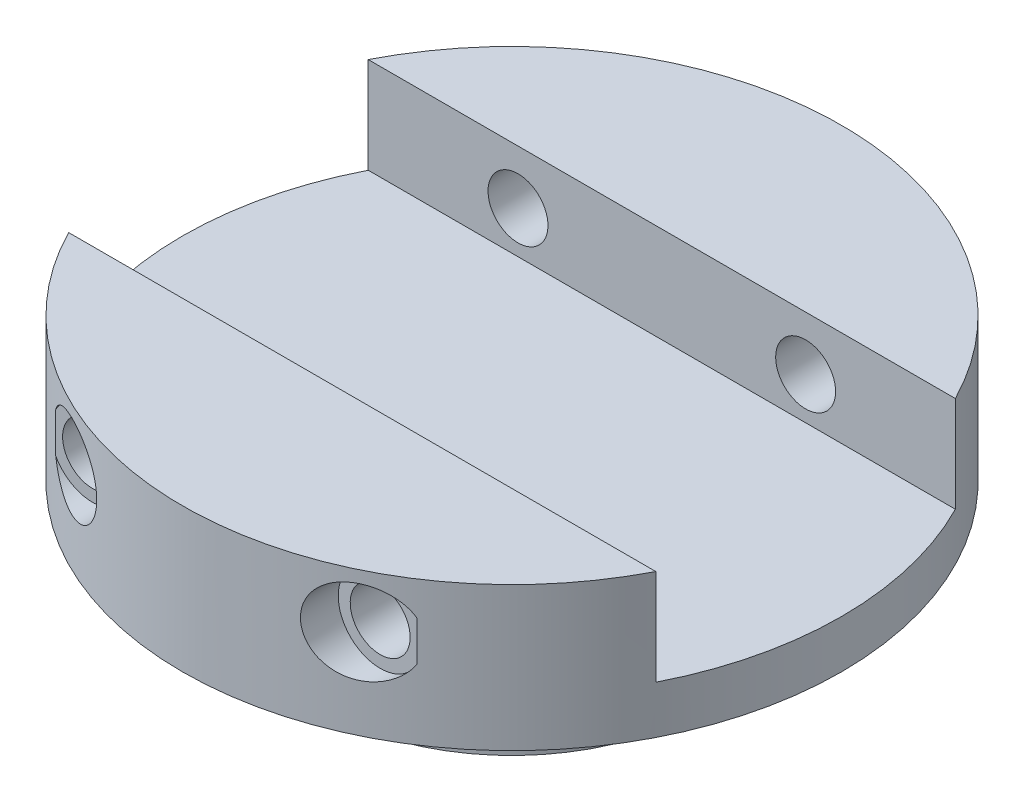
from build123d import *

# Parameters (mm, degrees)
SKETCH2_R               = 43.65625
BASE_EXTRUDE_DEPTH      = 19.05
SKETCH4_R               = 25.3619
BOSS_EXTRUDE1_DEPTH     = 13.49375
CUT_EXTRUDE1_DEPTH      = 65.611445024
CUT_EXTRUDE1_DEPTH_BACK = 65.611445024
SKETCH5_W               = 39.6875
SKETCH5_H               = 12.7
SKETCH7_R               = 3.96875
CUT_EXTRUDE2_DEPTH      = 65.611445024
SKETCH8_R               = 5.55625
CUT_EXTRUDE3_DEPTH      = 94.251268995
MIRROR2_COPY_1_SKETCH_R = 3.96875
MIRROR2_COPY_1_DEPTH    = 65.611445024
MIRROR2_COPY_2_SKETCH_R = 5.55625
MIRROR2_COPY_2_DEPTH    = 94.251268995


with BuildPart() as part:
    # Sketch2 → Base-Extrude (new body)
    with BuildSketch(Plane(origin=(0, 0, 0), x_dir=(1, 0, 0), z_dir=(0, 1, 0))):
        Circle(SKETCH2_R)
    extrude(amount=BASE_EXTRUDE_DEPTH)

    # Sketch4 → Boss-Extrude1 (add)
    with BuildSketch(Plane.XZ):
        Circle(SKETCH4_R)
    extrude(amount=BOSS_EXTRUDE1_DEPTH)

    # Sketch5 → Cut-Extrude1 (cut, two sides: drawn at the far end of the back side and taken through both)
    with BuildSketch(Plane(origin=(0, 0, 0), x_dir=(0, 0, -1), z_dir=(1, 0, 0)).offset(-CUT_EXTRUDE1_DEPTH_BACK)):
        with Locations((0, 12.7)):
            Rectangle(SKETCH5_W, SKETCH5_H)
    extrude(amount=CUT_EXTRUDE1_DEPTH + CUT_EXTRUDE1_DEPTH_BACK, mode=Mode.SUBTRACT)

    # Sketch7 → Cut-Extrude2 (cut, through all)
    with BuildSketch(Plane.XY):
        with Locations((-19.05, 11.90625)):
            Circle(SKETCH7_R)
    cut_extrude2 = extrude(amount=CUT_EXTRUDE2_DEPTH, mode=Mode.SUBTRACT)

    # Sketch8 → Cut-Extrude3 (cut, through all)
    with BuildSketch(Plane.XY.offset(36.5125)):
        with Locations((-19.05, 11.90625)):
            Circle(SKETCH8_R)
    cut_extrude3 = extrude(amount=CUT_EXTRUDE3_DEPTH, mode=Mode.SUBTRACT)

    # Mirror1: Cut-Extrude2, Cut-Extrude3 across plane
    add(cut_extrude2.mirror(Plane(origin=(0, 0, 0), x_dir=(0, 0, 1), z_dir=(1, 0, 0))), mode=Mode.SUBTRACT)
    add(cut_extrude3.mirror(Plane(origin=(0, 0, 0), x_dir=(0, 0, 1), z_dir=(1, 0, 0))), mode=Mode.SUBTRACT)

    # Mirror2: Cut-Extrude2, Cut-Extrude3 across plane
    add(cut_extrude2.mirror(Plane.XY), mode=Mode.SUBTRACT)
    add(cut_extrude3.mirror(Plane.XY), mode=Mode.SUBTRACT)

    # Mirror2 copy 1 sketch → Mirror2 copy 1 (cut, through all)
    with BuildSketch(Plane(origin=(0, 0, 0), x_dir=(-1, 0, 0), z_dir=(0, 0, -1))):
        with Locations((-19.05, 11.90625)):
            Circle(MIRROR2_COPY_1_SKETCH_R)
    extrude(amount=MIRROR2_COPY_1_DEPTH, mode=Mode.SUBTRACT)

    # Mirror2 copy 2 sketch → Mirror2 copy 2 (cut, through all)
    with BuildSketch(Plane(origin=(0, 0, -36.5125), x_dir=(-1, 0, 0), z_dir=(0, 0, -1))):
        with Locations((-19.05, 11.90625)):
            Circle(MIRROR2_COPY_2_SKETCH_R)
    extrude(amount=MIRROR2_COPY_2_DEPTH, mode=Mode.SUBTRACT)


solid = part.part
